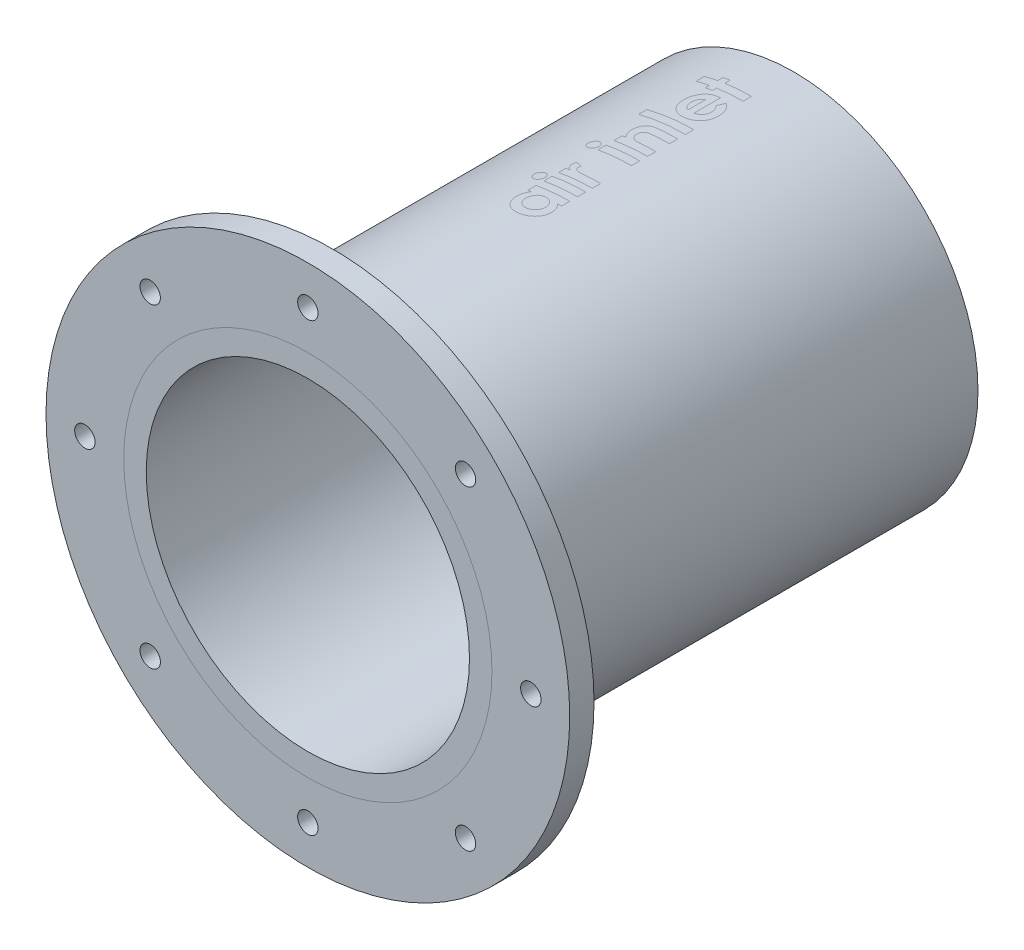
from build123d import *

# Parameters (mm, degrees)
SKETCH1_R           = 37.875
SKETCH1_R_2         = 33.25
EXTRUDE_THIN1_DEPTH = 100
SKETCH1_2_R         = 53.875
SKETCH1_2_R_2       = 37.875
EXTRUDE_THIN2_DEPTH = 5
SKETCH2_W           = 2.1
SKETCH2_H           = 100
CIRPATTERN5_COUNT   = 8


with BuildPart() as part:
    # Sketch1 → Extrude-Thin1 (new body)
    with BuildSketch(Plane.XY):
        Circle(SKETCH1_R)
        Circle(SKETCH1_R_2, mode=Mode.SUBTRACT)
    extrude(amount=-EXTRUDE_THIN1_DEPTH)


with BuildPart() as body_2:
    # Sketch1<2> → Extrude-Thin2 (new body)
    with BuildSketch(Plane.XY):
        Circle(SKETCH1_2_R)
        Circle(SKETCH1_2_R_2, mode=Mode.SUBTRACT)
    extrude(amount=-EXTRUDE_THIN2_DEPTH)

    # Sketch2 → Ø4.2 (4.2) Diameter Hole1 (revolve, cut)
    with BuildSketch(Plane(origin=(0, 45.875, 0), x_dir=(0, -1, 0), z_dir=(1, 0, 0))):
        with Locations((1.05, 50)):
            Rectangle(SKETCH2_W, SKETCH2_H)
    f_4_2_4_2_diameter_hole1 = revolve(axis=Axis((0, 45.875, 6.35), (0, 0, -1)), mode=Mode.SUBTRACT)

    # CirPattern5: Ø4.2 (4.2) Diameter Hole1 ×8 about axis
    cirpattern5_axis = Axis((0, 0, -5), (0, 0, 1))
    for i in range(1, CIRPATTERN5_COUNT):
        add(f_4_2_4_2_diameter_hole1.rotate(cirpattern5_axis, i * 360 / CIRPATTERN5_COUNT), mode=Mode.SUBTRACT)


solid = Compound([part.part, body_2.part])
